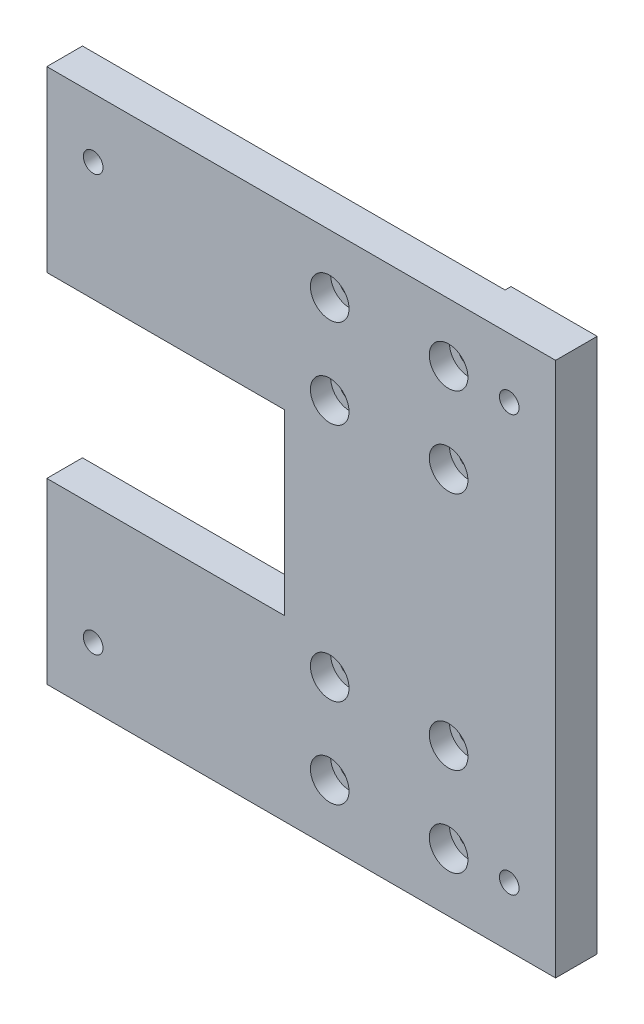
from build123d import *

# Parameters (mm, degrees)
SKETCH_1_W                   = 85.6
SKETCH_1_H                   = 90
EXTRUDE_1_DEPTH              = 6
SKETCH_2_W                   = 40
SKETCH_2_H                   = 30
CUT_EXTRUDE_1_DEPTH          = 125.351759135
SKETCH_3_W                   = 14.5
SKETCH_3_H                   = 90
EXTRUDE_2_DEPTH              = 1
HOLE_WIZARD_M3_1_D           = 3.4
HOLE_WIZARD_M3_1_CBORE_D     = 6.5
HOLE_WIZARD_M3_1_CBORE_DEPTH = 3.4
HOLE_WIZARD_M4_1_D           = 3.3


with BuildPart() as part:
    # 草图1 → 凸台-拉伸1 (new body)
    with BuildSketch(Plane.XY):
        with Locations((42.8, 45)):
            Rectangle(SKETCH_1_W, SKETCH_1_H)
    extrude(amount=EXTRUDE_1_DEPTH)

    # 草图2 → 切除-拉伸1 (cut, through all)
    with BuildSketch(Plane.XY.offset(6)):
        with Locations((20, 45)):
            Rectangle(SKETCH_2_W, SKETCH_2_H)
    extrude(amount=-CUT_EXTRUDE_1_DEPTH, mode=Mode.SUBTRACT)

    # 草图3 → 凸台-拉伸2 (add)
    with BuildSketch(Plane(origin=(0, 0, 0), x_dir=(-1, 0, 0), z_dir=(0, 0, -1))):
        with Locations((-78.35, 45)):
            Rectangle(SKETCH_3_W, SKETCH_3_H)
    extrude(amount=EXTRUDE_2_DEPTH)

    # M3 六角凹头螺钉的柱形沉头孔1 (through all)
    with Locations(Plane.XY.offset(6)):
        with Locations((67.6, 65.15), (47.6, 65.15), (67.6, 80.15), (47.6, 80.15)):
            hole_wizard_m3_1 = CounterBoreHole(HOLE_WIZARD_M3_1_D / 2, HOLE_WIZARD_M3_1_CBORE_D / 2, HOLE_WIZARD_M3_1_CBORE_DEPTH)

    # 镜向1: M3 六角凹头螺钉的柱形沉头孔1 across plane
    add(hole_wizard_m3_1.mirror(Plane.ZX.offset(45)), mode=Mode.SUBTRACT)

    # M4 螺纹孔1 (through all)
    with Locations(Plane.XY.offset(6)):
        with Locations((77.8, 10), (7.8, 10), (77.8, 80), (7.8, 80)):
            Hole(HOLE_WIZARD_M4_1_D / 2)


solid = part.part
